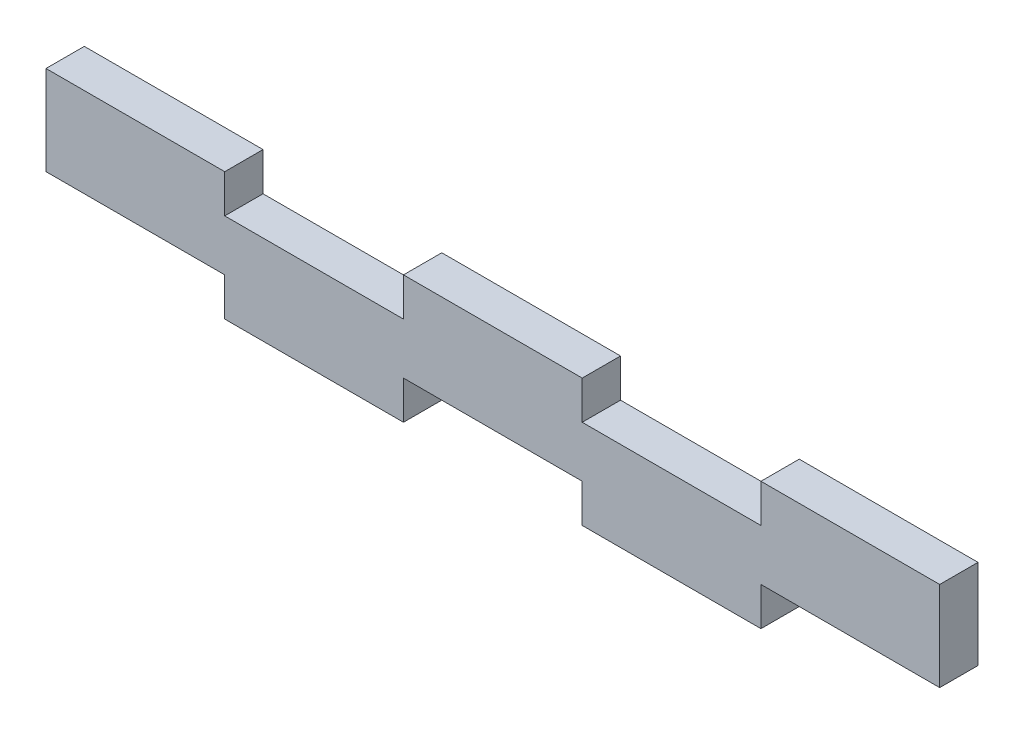
from build123d import *

# Parameters (mm, degrees)
BOSS_EXTRUDE1_DEPTH = 3


with BuildPart() as part:
    # Sketch1 → Boss-Extrude1 (new body)
    with BuildSketch(Plane.XY):
        Polygon((-7, 0), (7, 0), (7, -3), (21, -3), (21, 0), (35, 0), (35, 7), (21, 7), (21, 4), (7, 4), (7, 7), (-7, 7), (-7, 4), (-21, 4), (-21, 7), (-35, 7), (-35, 0), (-21, 0), (-21, -3), (-7, -3), align=None)
    extrude(amount=BOSS_EXTRUDE1_DEPTH)


solid = part.part
